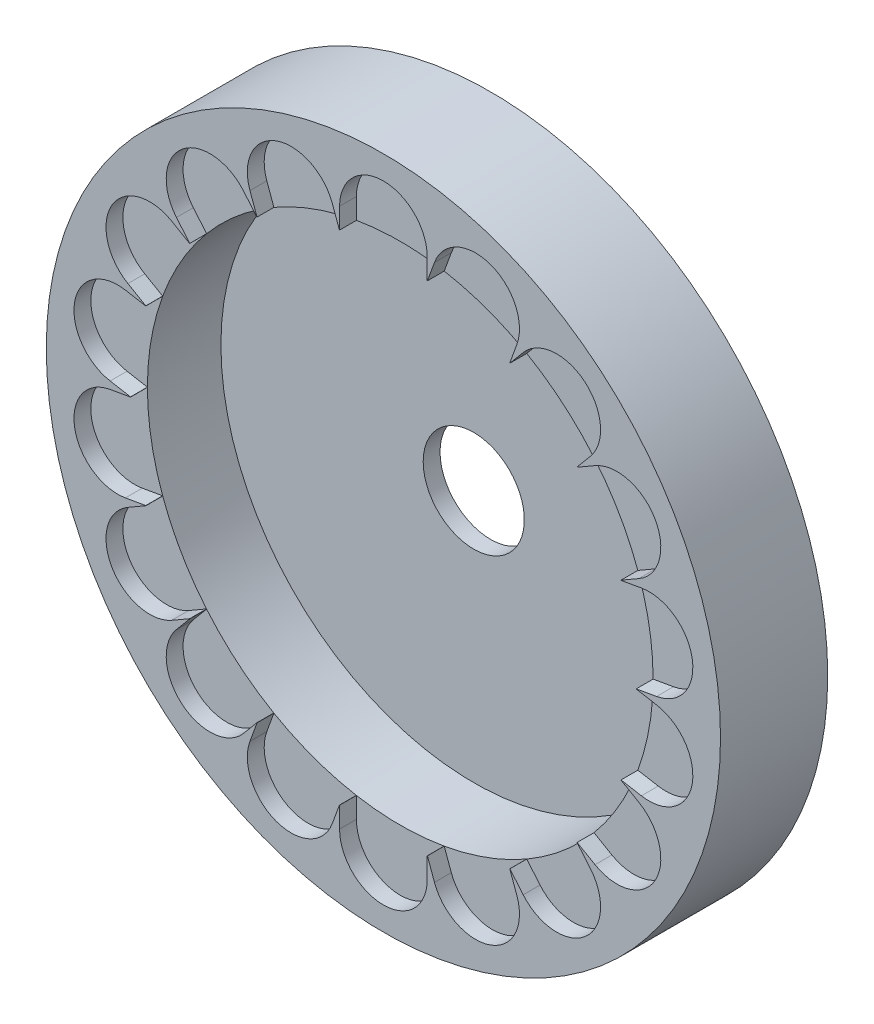
from build123d import *

# Parameters (mm, degrees)
SKETCH1_R           = 63.5
SKETCH1_R_2         = 47.625
BOSS_EXTRUDE1_DEPTH = 17.018
CUT_EXTRUDE1_DEPTH  = 3.175
CIRPATTERN1_COUNT   = 10
CIRPATTERN1_ANGLE   = 180
BOSS_EXTRUDE2_START = 3.175
SKETCH3_R           = 63.5
SKETCH3_R_2         = 9.525
BOSS_EXTRUDE2_DEPTH = 3.175


with BuildPart() as part:
    # Sketch1 → Boss-Extrude1 (new body)
    with BuildSketch(Plane.XY):
        Circle(SKETCH1_R)
        Circle(SKETCH1_R_2, mode=Mode.SUBTRACT)
    extrude(amount=BOSS_EXTRUDE1_DEPTH)

    # Sketch2 → Cut-Extrude1 (cut)
    with BuildSketch(Plane.XY.offset(17.018)):
        with BuildLine():
            Line((8.255, 50.8), (8.255, -50.8))
            ThreePointArc((8.255, -50.8), (0, -59.055), (-8.255, -50.8))
            Line((-8.255, -50.8), (-8.255, 50.8))
            ThreePointArc((-8.255, 50.8), (0, 59.055), (8.255, 50.8))
        make_face()
    cut_extrude1 = extrude(amount=-CUT_EXTRUDE1_DEPTH, mode=Mode.SUBTRACT)

    # CirPattern1: Cut-Extrude1 ×10 about axis
    cirpattern1_axis = Axis((0, 0, 17.018), (0, 0, 1))
    for i in range(1, CIRPATTERN1_COUNT):
        add(cut_extrude1.rotate(cirpattern1_axis, i * CIRPATTERN1_ANGLE / (CIRPATTERN1_COUNT - 1)), mode=Mode.SUBTRACT)

    # Sketch3 → Boss-Extrude2 (add)
    with BuildSketch(Plane(origin=(0, 0, 0), x_dir=(-1, 0, 0), z_dir=(0, 0, -1)).offset(BOSS_EXTRUDE2_START)):
        Circle(SKETCH3_R)
        Circle(SKETCH3_R_2, mode=Mode.SUBTRACT)
    extrude(amount=-BOSS_EXTRUDE2_DEPTH)


solid = part.part
